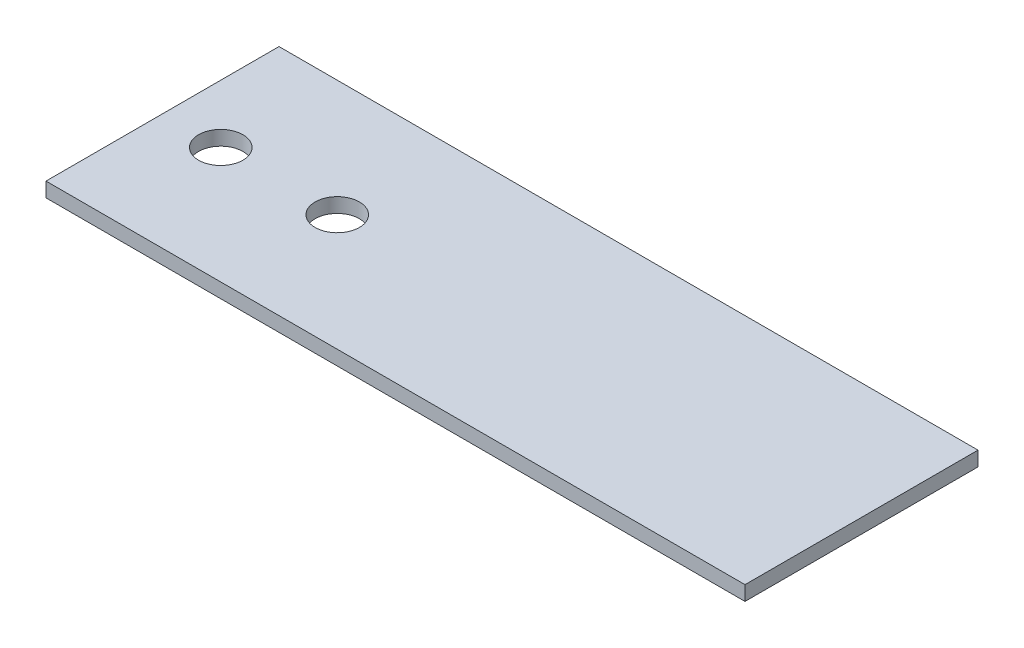
from build123d import *

# Parameters (mm, degrees)
SKETCH1_W            = 76.2
SKETCH1_H            = 25.4
ELECTRODE_BASE_DEPTH = 1.5875
SKETCH2_R            = 2.413
CUT_EXTRUDE1_DEPTH   = 81.337538898


with BuildPart() as part:
    # Sketch1 → Electrode Base (new body)
    with BuildSketch(Plane(origin=(0, 0, 0), x_dir=(1, 0, 0), z_dir=(0, 1, 0))):
        with Locations((38.1, 12.7)):
            Rectangle(SKETCH1_W, SKETCH1_H)
    extrude(amount=ELECTRODE_BASE_DEPTH)

    # Sketch2 → Cut-Extrude1 (cut, through all)
    with BuildSketch(Plane(origin=(0, 1.5875, 0), x_dir=(1, 0, 0), z_dir=(0, 1, 0))):
        with Locations((6.35, 12.7)):
            Circle(SKETCH2_R)
        with Locations((19.05, 12.7)):
            Circle(SKETCH2_R)
    extrude(amount=-CUT_EXTRUDE1_DEPTH, mode=Mode.SUBTRACT)


solid = part.part
